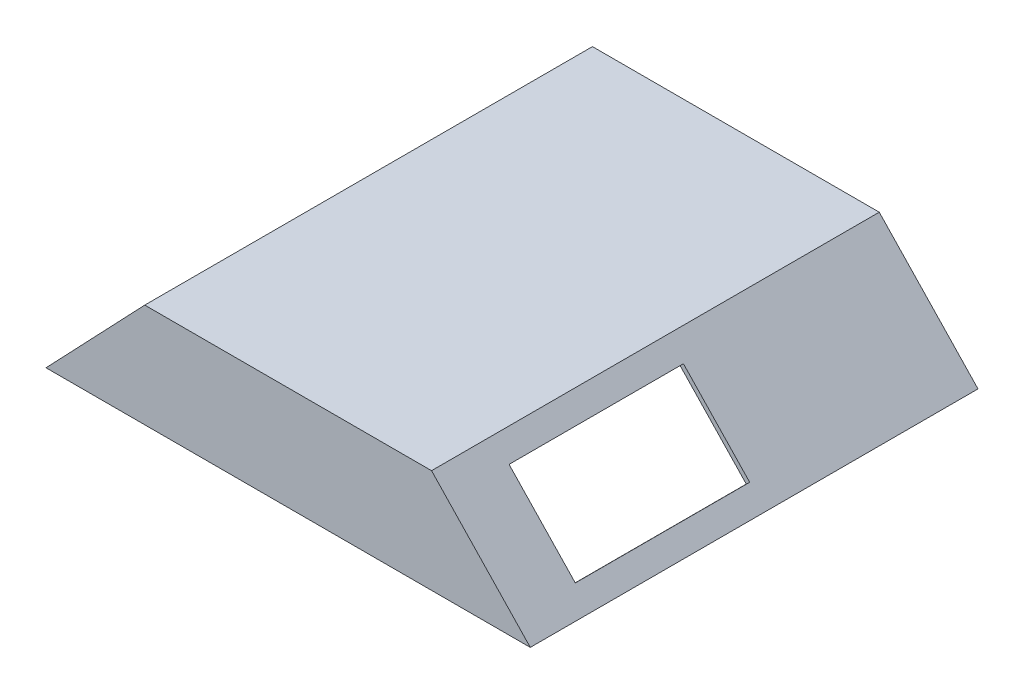
from build123d import *

# Parameters (mm, degrees)
SALIENTE_EXTRUIR1_DEPTH = 94
CORTAR_EXTRUIR2_REACH   = 127.016
CROQUIS3_W              = 37
CROQUIS3_H              = 20.380952381
SALIENTE_EXTRUIR2_DEPTH = 1


with BuildPart() as part:
    # Croquis1 → Saliente-Extruir1 (new body)
    with BuildSketch(Plane.XY):
        Polygon((-50, 0), (-51.380952381, 0), (-30.428571429, 22), (30.428571429, 22), (51.380952381, 0), (50, 0), (30, 21), (-30, 21), align=None)
    extrude(amount=SALIENTE_EXTRUIR1_DEPTH)

    # Croquis3 → Cortar-Extruir2 (cut, up to next)
    with BuildSketch(Plane(origin=(26.942925089, 25.659928656, 0), x_dir=(0, 0, -1), z_dir=(0.7241379310344828, 0.6896551724137933, 0)), mode=Mode.PRIVATE) as cortar_extruir2_sk1:
        with Locations((-63.5, -20.244663383)):
            Rectangle(CROQUIS3_W, CROQUIS3_H)
    cortar_extruir2_tool1 = extrude(cortar_extruir2_sk1.sketch, amount=-CORTAR_EXTRUIR2_REACH, mode=Mode.PRIVATE) & part.part
    add(cortar_extruir2_tool1.solids().sort_by_distance((40.904762, 11, 63.5))[0], mode=Mode.SUBTRACT)

    # Croquis4 → Saliente-Extruir2 (add)
    with BuildSketch(Plane.XY.offset(94)):
        Polygon((-51.380952381, 0), (51.380952381, 0), (30.428571429, 22), (-30.428571429, 22), align=None)
    extrude(amount=SALIENTE_EXTRUIR2_DEPTH)


solid = part.part
